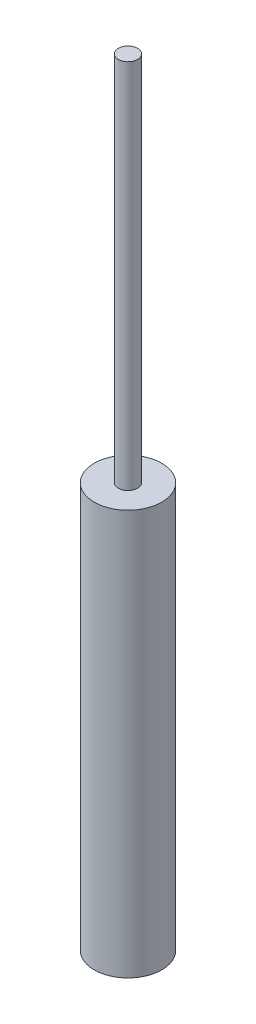
from build123d import *

# Parameters (mm, degrees)
SKETCH1_R           = 2.5
BOSS_EXTRUDE1_DEPTH = 15
SKETCH2_R           = 0.715
BOSS_EXTRUDE2_DEPTH = 27.5


with BuildPart() as part:
    # Sketch1 → Boss-Extrude1 (new, symmetric)
    with BuildSketch(Plane(origin=(0, 0, 0), x_dir=(1, 0, 0), z_dir=(0, 1, 0))):
        Circle(SKETCH1_R)
    extrude(amount=BOSS_EXTRUDE1_DEPTH, both=True)

    # Sketch2 → Boss-Extrude2 (add)
    with BuildSketch(Plane(origin=(0, 15, 0), x_dir=(1, 0, 0), z_dir=(0, 1, 0))):
        Circle(SKETCH2_R)
    extrude(amount=BOSS_EXTRUDE2_DEPTH)


solid = part.part
